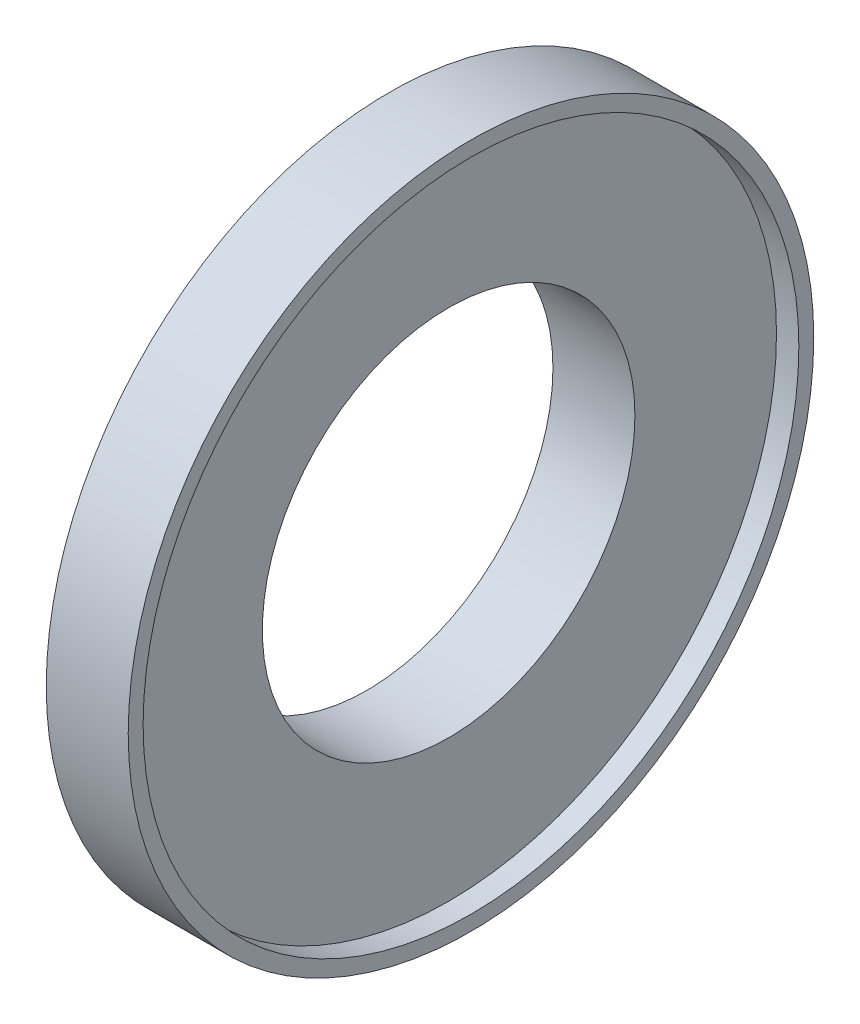
from build123d import *

# Parameters (mm, degrees)
SKETCH1_R           = 5.842
BOSS_EXTRUDE1_DEPTH = 1.397
SKETCH2_R           = 5.588
CUT_EXTRUDE1_DEPTH  = 0.381
SKETCH3_R           = 3.175
CUT_EXTRUDE2_DEPTH  = 9.324072561
SKETCH4_R           = 3.81
BOSS_EXTRUDE2_DEPTH = 0.381
CHAMFER1_SIZE       = 0.381
SKETCH5_R           = 3.175
CUT_EXTRUDE3_DEPTH  = 9.379113139


with BuildPart() as part:
    # Sketch1 → Boss-Extrude1 (new body)
    with BuildSketch(Plane(origin=(0, 0, 0), x_dir=(0, 0, -1), z_dir=(1, 0, 0))):
        Circle(SKETCH1_R)
    extrude(amount=BOSS_EXTRUDE1_DEPTH)

    # Sketch2 → Cut-Extrude1 (cut)
    with BuildSketch(Plane(origin=(1.397, 0, 0), x_dir=(0, 0, -1), z_dir=(1, 0, 0))):
        Circle(SKETCH2_R)
    extrude(amount=-CUT_EXTRUDE1_DEPTH, mode=Mode.SUBTRACT)

    # Sketch3 → Cut-Extrude2 (cut, through all)
    with BuildSketch(Plane(origin=(1.016, 0, 0), x_dir=(0, 0, -1), z_dir=(1, 0, 0))):
        Circle(SKETCH3_R)
    extrude(amount=-CUT_EXTRUDE2_DEPTH, mode=Mode.SUBTRACT)

    # Sketch4 → Boss-Extrude2 (add)
    with BuildSketch(Plane.ZY):
        with Locations(Location((0, 0, 0), (0, 0, 180))):
            Circle(SKETCH4_R)
    extrude(amount=BOSS_EXTRUDE2_DEPTH)

    # Chamfer1
    chamfer1_edges = [part.edges().sort_by_distance(p)[0] for p in [
        (0, 0, 3.81),
    ]]
    chamfer(chamfer1_edges, length=CHAMFER1_SIZE - 0.0001)  # a hair under: the kernel refuses the full size

    # Sketch5 → Cut-Extrude3 (cut, through all)
    with BuildSketch(Plane(origin=(0, 0, 0), x_dir=(0, 0, -1), z_dir=(1, 0, 0))):
        Circle(SKETCH5_R)
    extrude(amount=-CUT_EXTRUDE3_DEPTH, mode=Mode.SUBTRACT)


solid = part.part
